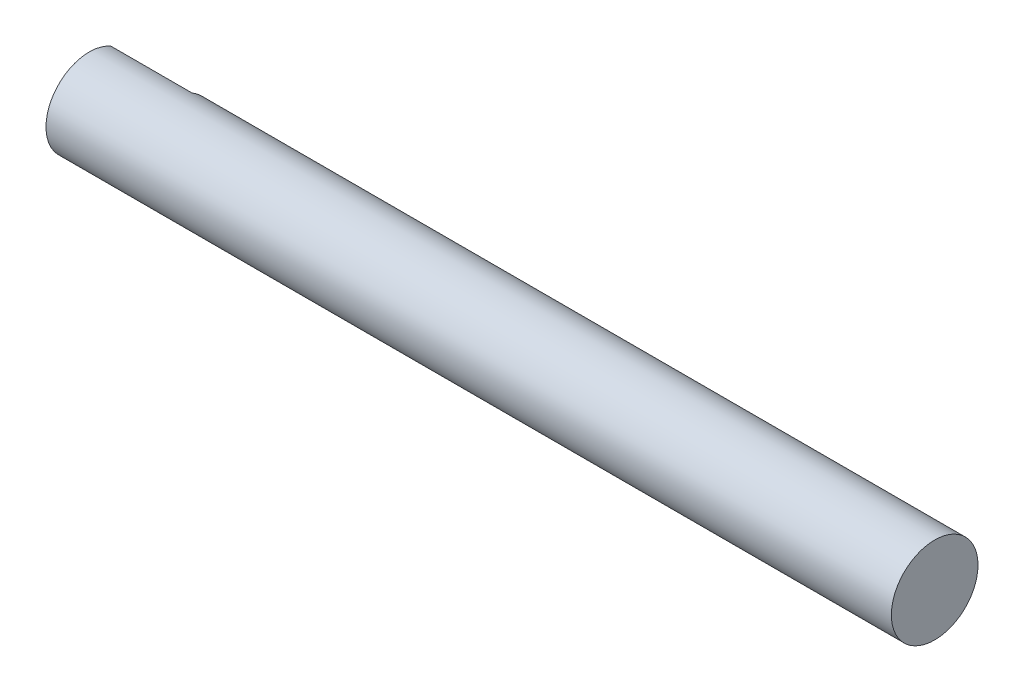
from build123d import *

# Parameters (mm, degrees)
BOSS_EXTRUDE1_DEPTH = 7.5
SKETCH2_R           = 3.995
BOSS_EXTRUDE2_DEPTH = 70.446


with BuildPart() as part:
    # Sketch1 → Boss-Extrude1 (new body)
    with BuildSketch(Plane(origin=(0, 0, 0), x_dir=(0, 0, -1), z_dir=(1, 0, 0))):
        with BuildLine():
            Line((1.985, 3.466958321), (1.985, -3.466958321))
            ThreePointArc((1.985, -3.466958321), (-3.995, 0), (1.985, 3.466958321))
        make_face()
    extrude(amount=BOSS_EXTRUDE1_DEPTH)

    # Sketch2 → Boss-Extrude2 (add)
    with BuildSketch(Plane(origin=(7.5, 0, 0), x_dir=(0, 0, -1), z_dir=(1, 0, 0))):
        Circle(SKETCH2_R)
    extrude(amount=BOSS_EXTRUDE2_DEPTH)


solid = part.part
